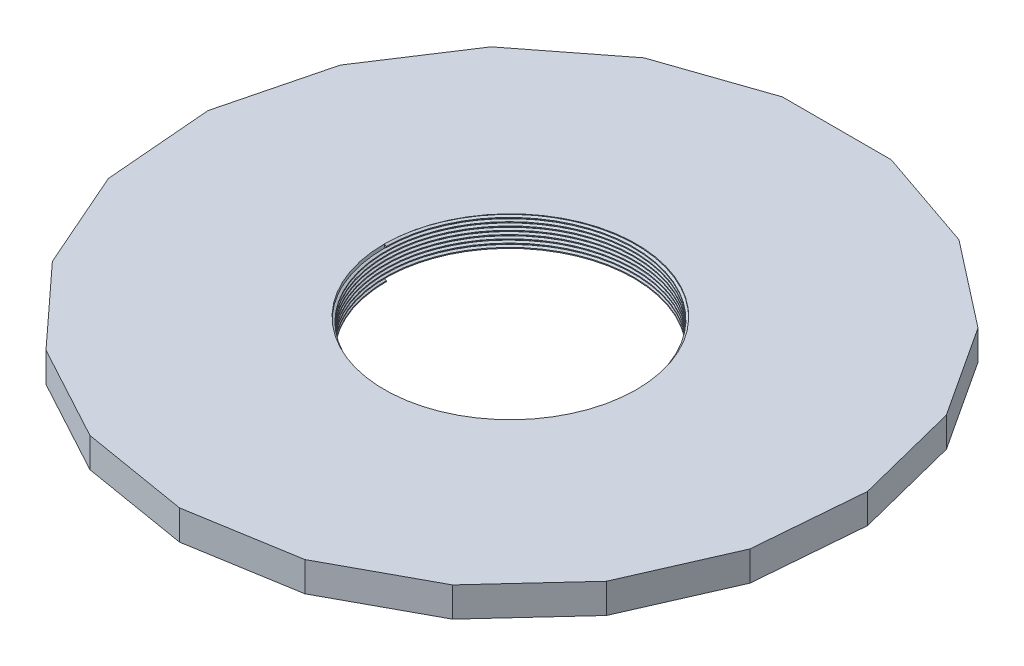
from build123d import *

# Parameters (mm, degrees)
BOSS_EXTRUDE4_DEPTH = 2
SKETCH14_R          = 8.5
CUT_EXTRUDE3_DEPTH  = 32.552531175
THREAD4_PITCH       = 0.25


with BuildPart() as part:
    # Sketch10 → Boss-Extrude4 (new body)
    with BuildSketch(Plane(origin=(0, 0, 0), x_dir=(1, 0, 0), z_dir=(0, 1, 0))):
        Polygon((-21.621697624, -5.475357456), (-18.672328748, -12.199241229), (-13.699523321, -17.601147923), (-7.242161972, -21.09569713), (0, -22.30420022), (7.242161972, -21.09569713), (13.699523321, -17.601147923), (18.672328748, -12.199241229), (21.621697624, -5.475357456), (22.228020068, 1.841866255), (20.425591634, 8.959495179), (16.40973341, 15.106223779), (10.615625948, 19.615958635), (3.671150697, 22), (-3.671150697, 22), (-10.615625948, 19.615958635), (-16.40973341, 15.106223779), (-20.425591634, 8.959495179), (-22.228020068, 1.841866255), align=None)
    extrude(amount=BOSS_EXTRUDE4_DEPTH)

    # Sketch14 → Cut-Extrude3 (cut, through all)
    with BuildSketch(Plane(origin=(0, 2, 0), x_dir=(1, 0, 0), z_dir=(0, 1, 0))):
        with Locations(Location((0, 0, 0), (0, 0, 270))):
            Circle(SKETCH14_R)
    extrude(amount=-CUT_EXTRUDE3_DEPTH, mode=Mode.SUBTRACT)

    # Thread4: the profile of Thread Profile4 profile screwed along a right-hand helix of 8 turns, 6 arcs to a turn; built about Z, then put on its axis
    thread4_z = Axis((0, 0, 0), (0, 0, 1))
    thread4_corners = [(8.5003, 0, -0.000173205), (8.5003, 0, 0.218923204), (8.364683531, 0, 0.140625), (8.364683531, 0, 0.078125)]
    with BuildLine(mode=Mode.PRIVATE) as thread4_profile:
        Line(thread4_corners[0], thread4_corners[1])
        Line(thread4_corners[1], thread4_corners[2])
        Line(thread4_corners[2], thread4_corners[3])
        Line(thread4_corners[3], thread4_corners[0])
    thread4_cap = Face(thread4_profile.wire())
    thread4_turn_angles = [0, 30, 60, 90, 120, 150, 180, 210, 240, 270, 300, 330, 360]
    thread4_turn_weights = [1, 0.8660254037844387, 1, 0.8660254037844387, 1, 0.8660254037844387, 1, 0.8660254037844387, 1, 0.8660254037844387, 1, 0.8660254037844387, 1]
    thread4_turn_rails = [Edge.make_bspline([Vector(p[0], p[1], 0).rotate(thread4_z, thread4_turn_angles[k]) / thread4_turn_weights[k] + Vector(0, 0, p[2] + THREAD4_PITCH * thread4_turn_angles[k] / 360) for k in range(13)], [0, 0, 0, 1, 1, 2, 2, 3, 3, 4, 4, 5, 5, 6, 6, 6], 2, thread4_turn_weights) for p in thread4_corners]
    thread4_turn_sides = [Face.make_surface_from_curves(thread4_turn_rails[p[0]], thread4_turn_rails[p[1]]) for p in [(0, 1), (1, 2), (2, 3), (3, 0)]]
    thread4 = Plane(origin=(0, 2, 0), x_dir=(-1, 0, 0), z_dir=(0, -1, 0)) * Solid(Shell([*[p.moved(Location((0, 0, THREAD4_PITCH * i))) for i in range(8) for p in thread4_turn_sides], thread4_cap, thread4_cap.rotate(thread4_z, 2880).moved(Location((0, 0, THREAD4_PITCH * 2880 / 360)))]))
    add(thread4)


solid = part.part
